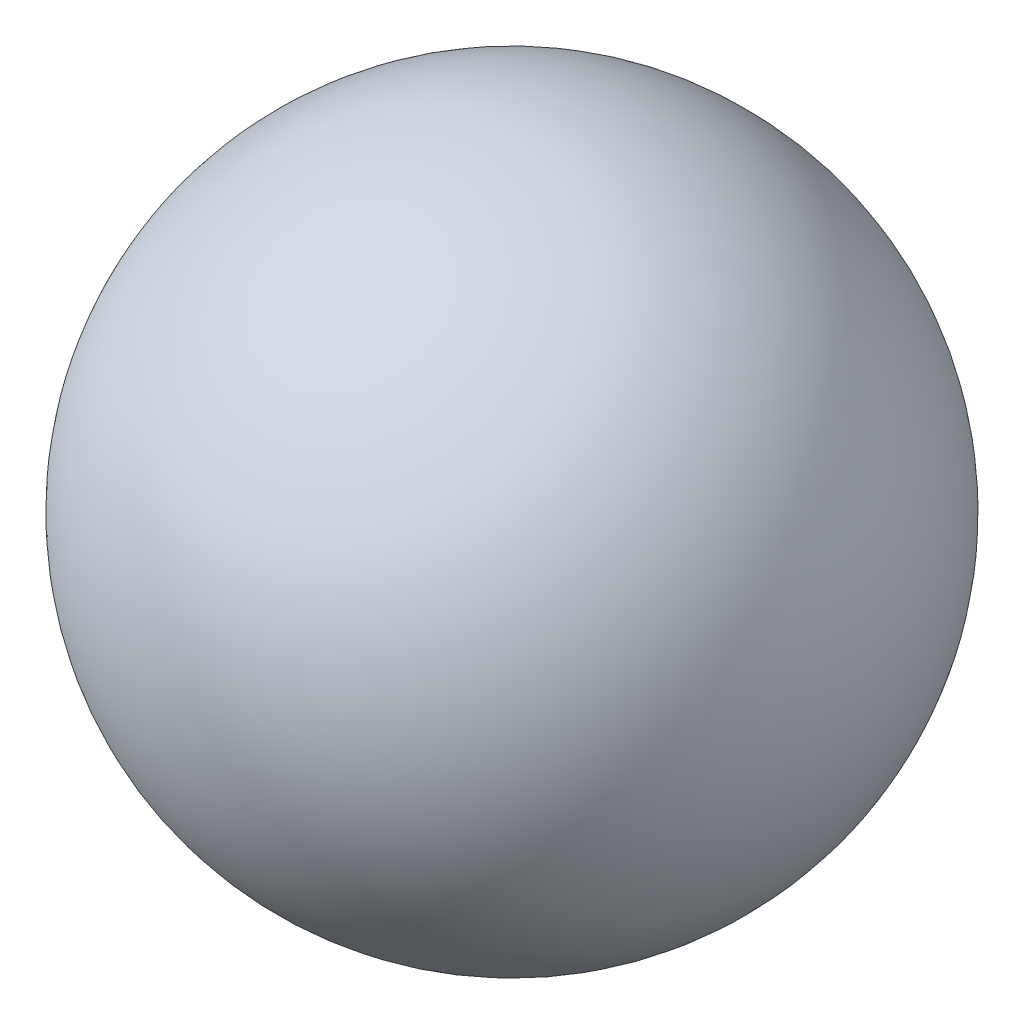
from build123d import *


with BuildPart() as part:
    # Sketch1 → Revolve1 (revolve)
    with BuildSketch(Plane.XY):
        with BuildLine():
            Line((-3.2, 0), (3.2, 0))
            ThreePointArc((3.2, 0), (0, 3.2), (-3.2, 0))
        make_face()
    revolve(axis=Axis((-3.2, 0, 0), (1, 0, 0)))


solid = part.part
